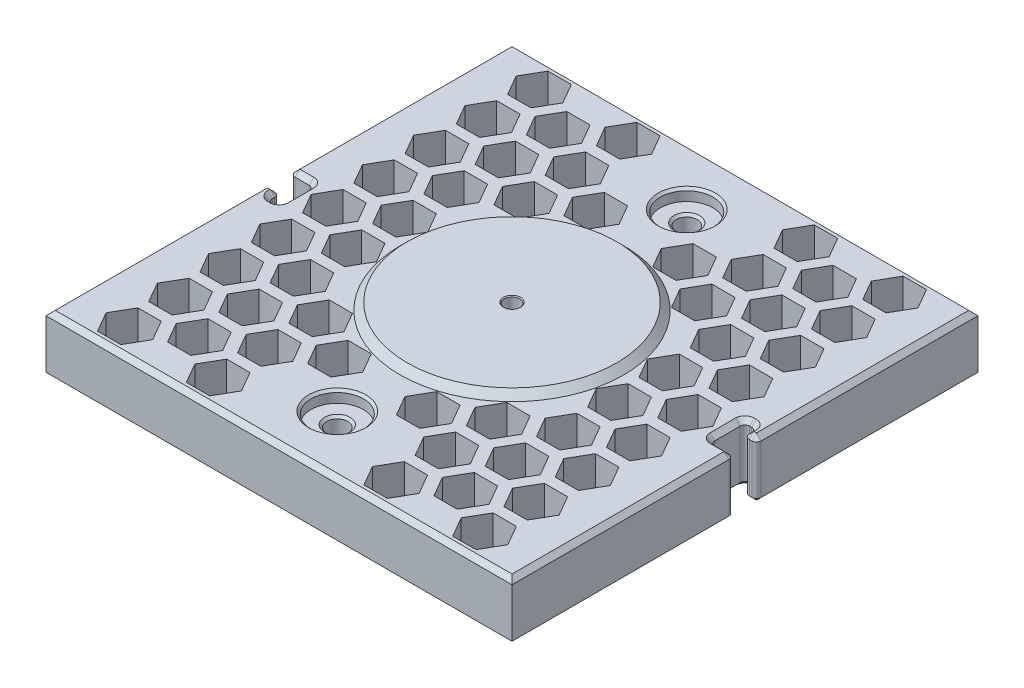
from build123d import *

# Parameters (mm, degrees)
SKETCH1_W           = 200
SKETCH1_H           = 200
BOSS_EXTRUDE1_DEPTH = 25
CUT_EXTRUDE3_REACH  = 145.614
FILLET2_R           = 2
SKETCH4_R           = 45
BOSS_EXTRUDE3_DEPTH = 3
CHAMFER1_SIZE       = 3
SKETCH5_R           = 4.5
CUT_EXTRUDE4_DEPTH  = 144.614066163
SKETCH8_R           = 11.25
CUT_EXTRUDE6_DEPTH  = 5
CHAMFER3_SIZE       = 1
FILL_PATTERN1_DEPTH = 25
CHAMFER4_SIZE       = 2
SKETCH9_R           = 3.3
CUT_EXTRUDE8_DEPTH  = 10
CHAMFER5_SIZE       = 0.4


# Read off the part's stored shape, not the designer's step: Fill Pattern1
with BuildPart() as part:
    # Sketch1 → Boss-Extrude1 (new body)
    with BuildSketch(Plane(origin=(0, 0, 0), x_dir=(1, 0, 0), z_dir=(0, 1, 0))):
        Rectangle(SKETCH1_W, SKETCH1_H)
    extrude(amount=BOSS_EXTRUDE1_DEPTH)

    # Sketch3 → Cut-Extrude3 (cut, up to next)
    with BuildSketch(Plane(origin=(0, 0, 0), x_dir=(1, 0, 0), z_dir=(0, 1, 0)), mode=Mode.PRIVATE) as cut_extrude3_sk1:
        with BuildLine():
            Line((-100, 4.95), (-92, 4.95))
            ThreePointArc((-92, 4.95), (-90.585786438, 4.364213562), (-90, 2.95))
            Line((-90, 2.95), (-90, -7.95))
            ThreePointArc((-90, -7.95), (-90.585786438, -9.364213562), (-92, -9.95))
            Line((-92, -9.95), (-92.9, -9.95))
            ThreePointArc((-92.9, -9.95), (-94.314213562, -9.364213562), (-94.9, -7.95))
            Line((-94.9, -7.95), (-94.9, -6.95))
            ThreePointArc((-94.9, -6.95), (-95.485786438, -5.535786438), (-96.9, -4.95))
            Line((-96.9, -4.95), (-100, -4.95))
            Line((-100, -4.95), (-100, 4.95))
        make_face()
    cut_extrude3_tool1 = extrude(cut_extrude3_sk1.sketch, amount=CUT_EXTRUDE3_REACH, mode=Mode.PRIVATE) & part.part
    # Sketch3 → Cut-Extrude3 (cut, up to next)
    with BuildSketch(Plane(origin=(0, 0, 0), x_dir=(1, 0, 0), z_dir=(0, 1, 0)), mode=Mode.PRIVATE) as cut_extrude3_sk2:
        with BuildLine():
            Line((100, -4.95), (92, -4.95))
            ThreePointArc((92, -4.95), (90.585786438, -4.364213562), (90, -2.95))
            Line((90, -2.95), (90, 7.95))
            ThreePointArc((90, 7.95), (90.585786438, 9.364213562), (92, 9.95))
            Line((92, 9.95), (92.9, 9.95))
            ThreePointArc((92.9, 9.95), (94.314213562, 9.364213562), (94.9, 7.95))
            Line((94.9, 7.95), (94.9, 6.95))
            ThreePointArc((94.9, 6.95), (95.485786438, 5.535786438), (96.9, 4.95))
            Line((96.9, 4.95), (100, 4.95))
            Line((100, 4.95), (100, -4.95))
        make_face()
    cut_extrude3_tool2 = extrude(cut_extrude3_sk2.sketch, amount=CUT_EXTRUDE3_REACH, mode=Mode.PRIVATE) & part.part
    add(cut_extrude3_tool1.solids().sort_by_distance((-94.557485, 0, 1.434581))[0], mode=Mode.SUBTRACT)
    add(cut_extrude3_tool2.solids().sort_by_distance((94.557485, 0, -1.434581))[0], mode=Mode.SUBTRACT)

    # Fillet2
    fillet2_edges = [part.edges().sort_by_distance(p)[0] for p in [
        (-100, 12.5, -4.95),
        (-100, 12.5, 4.95),
        (100, 12.5, 4.95),
        (100, 12.5, -4.95),
    ]]
    fillet(fillet2_edges, radius=FILLET2_R)

    # Sketch4 → Boss-Extrude3 (add)
    with BuildSketch(Plane(origin=(0, 25, 0), x_dir=(1, 0, 0), z_dir=(0, 1, 0))):
        with Locations(Location((0, 0, 0), (0, 0, 270))):
            Circle(SKETCH4_R)
    extrude(amount=BOSS_EXTRUDE3_DEPTH)

    # Chamfer1
    chamfer1_edges = [part.edges().sort_by_distance(p)[0] for p in [
        (0, 25, -45),
    ]]
    chamfer(chamfer1_edges, length=CHAMFER1_SIZE - 0.0001)  # a hair under: the kernel refuses the full size

    # Sketch5 → Cut-Extrude4 (cut, through all)
    with BuildSketch(Plane(origin=(0, 25, 0), x_dir=(1, 0, 0), z_dir=(0, 1, 0))):
        with Locations(Location((0, 75, 0), (0, 0, 270))):
            Circle(SKETCH5_R)
        with Locations(Location((0, -75, 0), (0, 0, 90))):
            Circle(SKETCH5_R)
    extrude(amount=-CUT_EXTRUDE4_DEPTH, mode=Mode.SUBTRACT)

    # Sketch8 → Cut-Extrude6 (cut)
    with BuildSketch(Plane(origin=(0, 25, 0), x_dir=(1, 0, 0), z_dir=(0, 1, 0))):
        with Locations(Location((0, 75, 0), (0, 0, 270))):
            Circle(SKETCH8_R)
        with Locations(Location((0, -75, 0), (0, 0, 90))):
            Circle(SKETCH8_R)
    extrude(amount=-CUT_EXTRUDE6_DEPTH, mode=Mode.SUBTRACT)

    # Chamfer3
    chamfer3_edges = [part.edges().sort_by_distance(p)[0] for p in [
        (0, 25, -86.25),
        (0, 20, -79.5),
        (0, 20, 79.5),
        (0, 25, 86.25),
    ]]
    chamfer(chamfer3_edges, length=CHAMFER3_SIZE)

    # Fill Pattern1 outline → Fill Pattern1 (cut)
    with BuildSketch(Plane(origin=(0, 0, 0), x_dir=(1, 0, 0), z_dir=(0, 1, 0))):
        Polygon((-86.210235533, 88), (-81.210235533, 79.339745962), (-71.210235533, 79.339745962), (-66.210235533, 88), (-71.210235533, 96.660254038), (-81.210235533, 96.660254038), align=None)
        Polygon((-67.15767665, 55), (-62.15767665, 46.339745962), (-52.15767665, 46.339745962), (-47.15767665, 55), (-52.15767665, 63.660254038), (-62.15767665, 63.660254038), align=None)
        Polygon((-43.105117767, 79.339745962), (-33.105117767, 79.339745962), (-28.105117767, 88), (-33.105117767, 96.660254038), (-43.105117767, 96.660254038), (-48.105117767, 88), align=None)
        Polygon((33.105117767, 79.339745962), (43.105117767, 79.339745962), (48.105117767, 88), (43.105117767, 96.660254038), (33.105117767, 96.660254038), (28.105117767, 88), align=None)
        Polygon((71.210235533, 79.339745962), (81.210235533, 79.339745962), (86.210235533, 88), (81.210235533, 96.660254038), (71.210235533, 96.660254038), (66.210235533, 88), align=None)
        Polygon((-86.210235533, -22), (-81.210235533, -30.660254038), (-71.210235533, -30.660254038), (-66.210235533, -22), (-71.210235533, -13.339745962), (-81.210235533, -13.339745962), align=None)
        Polygon((-48.105117767, -88), (-43.105117767, -96.660254038), (-33.105117767, -96.660254038), (-28.105117767, -88), (-33.105117767, -79.339745962), (-43.105117767, -79.339745962), align=None)
        Polygon((-67.15767665, -55), (-62.15767665, -63.660254038), (-52.15767665, -63.660254038), (-47.15767665, -55), (-52.15767665, -46.339745962), (-62.15767665, -46.339745962), align=None)
        Polygon((71.210235533, -30.660254038), (81.210235533, -30.660254038), (86.210235533, -22), (81.210235533, -13.339745962), (71.210235533, -13.339745962), (66.210235533, -22), align=None)
        Polygon((-52.15767665, 2.339745962), (-47.15767665, 11), (-52.15767665, 19.660254038), (-62.15767665, 19.660254038), (-67.15767665, 11), (-62.15767665, 2.339745962), align=None)
        Polygon((-33.105117767, 35.339745962), (-28.105117767, 44), (-33.105117767, 52.660254038), (-43.105117767, 52.660254038), (-48.105117767, 44), (-43.105117767, 35.339745962), align=None)
        Polygon((-29.052558883, -55), (-24.052558883, -63.660254038), (-14.052558883, -63.660254038), (-9.052558883, -55), (-14.052558883, -46.339745962), (-24.052558883, -46.339745962), align=None)
        Polygon((-86.210235533, 44), (-81.210235533, 35.339745962), (-71.210235533, 35.339745962), (-66.210235533, 44), (-71.210235533, 52.660254038), (-81.210235533, 52.660254038), align=None)
        Polygon((52.15767665, 2.339745962), (62.15767665, 2.339745962), (67.15767665, 11), (62.15767665, 19.660254038), (52.15767665, 19.660254038), (47.15767665, 11), align=None)
        Polygon((-86.210235533, 22), (-81.210235533, 13.339745962), (-71.210235533, 13.339745962), (-66.210235533, 22), (-71.210235533, 30.660254038), (-81.210235533, 30.660254038), align=None)
        Polygon((-67.15767665, -11), (-62.15767665, -19.660254038), (-52.15767665, -19.660254038), (-47.15767665, -11), (-52.15767665, -2.339745962), (-62.15767665, -2.339745962), align=None)
        Polygon((-48.105117767, -44), (-43.105117767, -52.660254038), (-33.105117767, -52.660254038), (-28.105117767, -44), (-33.105117767, -35.339745962), (-43.105117767, -35.339745962), align=None)
        Polygon((71.210235533, 13.339745962), (81.210235533, 13.339745962), (86.210235533, 22), (81.210235533, 30.660254038), (71.210235533, 30.660254038), (66.210235533, 22), align=None)
        Polygon((9.052558883, -55), (14.052558883, -63.660254038), (24.052558883, -63.660254038), (29.052558883, -55), (24.052558883, -46.339745962), (14.052558883, -46.339745962), align=None)
        Polygon((28.105117767, -88), (33.105117767, -96.660254038), (43.105117767, -96.660254038), (48.105117767, -88), (43.105117767, -79.339745962), (33.105117767, -79.339745962), align=None)
        Polygon((-67.15767665, 77), (-62.15767665, 68.339745962), (-52.15767665, 68.339745962), (-47.15767665, 77), (-52.15767665, 85.660254038), (-62.15767665, 85.660254038), align=None)
        Polygon((52.15767665, -63.660254038), (62.15767665, -63.660254038), (67.15767665, -55), (62.15767665, -46.339745962), (52.15767665, -46.339745962), (47.15767665, -55), align=None)
        Polygon((81.210235533, 35.339745962), (86.210235533, 44), (81.210235533, 52.660254038), (71.210235533, 52.660254038), (66.210235533, 44), (71.210235533, 35.339745962), align=None)
        Polygon((-86.210235533, 0), (-81.210235533, -8.660254038), (-71.210235533, -8.660254038), (-66.210235533, 0), (-71.210235533, 8.660254038), (-81.210235533, 8.660254038), align=None)
        Polygon((-48.105117767, -66), (-43.105117767, -74.660254038), (-33.105117767, -74.660254038), (-28.105117767, -66), (-33.105117767, -57.339745962), (-43.105117767, -57.339745962), align=None)
        Polygon((-67.15767665, -33), (-62.15767665, -41.660254038), (-52.15767665, -41.660254038), (-47.15767665, -33), (-52.15767665, -24.339745962), (-62.15767665, -24.339745962), align=None)
        Polygon((71.210235533, -8.660254038), (81.210235533, -8.660254038), (86.210235533, 0), (81.210235533, 8.660254038), (71.210235533, 8.660254038), (66.210235533, 0), align=None)
        Polygon((-52.15767665, 24.339745962), (-47.15767665, 33), (-52.15767665, 41.660254038), (-62.15767665, 41.660254038), (-67.15767665, 33), (-62.15767665, 24.339745962), align=None)
        Polygon((-33.105117767, 57.339745962), (-28.105117767, 66), (-33.105117767, 74.660254038), (-43.105117767, 74.660254038), (-48.105117767, 66), (-43.105117767, 57.339745962), align=None)
        Polygon((-81.210235533, -96.660254038), (-71.210235533, -96.660254038), (-66.210235533, -88), (-71.210235533, -79.339745962), (-81.210235533, -79.339745962), (-86.210235533, -88), align=None)
        Polygon((71.210235533, -96.660254038), (81.210235533, -96.660254038), (86.210235533, -88), (81.210235533, -79.339745962), (71.210235533, -79.339745962), (66.210235533, -88), align=None)
        Polygon((62.15767665, 68.339745962), (67.15767665, 77), (62.15767665, 85.660254038), (52.15767665, 85.660254038), (47.15767665, 77), (52.15767665, 68.339745962), align=None)
        Polygon((43.105117767, 35.339745962), (48.105117767, 44), (43.105117767, 52.660254038), (33.105117767, 52.660254038), (28.105117767, 44), (33.105117767, 35.339745962), align=None)
        Polygon((-86.210235533, -66), (-81.210235533, -74.660254038), (-71.210235533, -74.660254038), (-66.210235533, -66), (-71.210235533, -57.339745962), (-81.210235533, -57.339745962), align=None)
        Polygon((33.105117767, -74.660254038), (43.105117767, -74.660254038), (48.105117767, -66), (43.105117767, -57.339745962), (33.105117767, -57.339745962), (28.105117767, -66), align=None)
        Polygon((71.210235533, -74.660254038), (81.210235533, -74.660254038), (86.210235533, -66), (81.210235533, -57.339745962), (71.210235533, -57.339745962), (66.210235533, -66), align=None)
        Polygon((-67.15767665, -77), (-62.15767665, -85.660254038), (-52.15767665, -85.660254038), (-47.15767665, -77), (-52.15767665, -68.339745962), (-62.15767665, -68.339745962), align=None)
        Polygon((-86.210235533, -44), (-81.210235533, -52.660254038), (-71.210235533, -52.660254038), (-66.210235533, -44), (-71.210235533, -35.339745962), (-81.210235533, -35.339745962), align=None)
        Polygon((52.15767665, -85.660254038), (62.15767665, -85.660254038), (67.15767665, -77), (62.15767665, -68.339745962), (52.15767665, -68.339745962), (47.15767665, -77), align=None)
        Polygon((24.052558883, 46.339745962), (29.052558883, 55), (24.052558883, 63.660254038), (14.052558883, 63.660254038), (9.052558883, 55), (14.052558883, 46.339745962), align=None)
        Polygon((62.15767665, -41.660254038), (67.15767665, -33), (62.15767665, -24.339745962), (52.15767665, -24.339745962), (47.15767665, -33), (52.15767665, -41.660254038), align=None)
        Polygon((-86.210235533, 66), (-81.210235533, 57.339745962), (-71.210235533, 57.339745962), (-66.210235533, 66), (-71.210235533, 74.660254038), (-81.210235533, 74.660254038), align=None)
        Polygon((52.15767665, 24.339745962), (62.15767665, 24.339745962), (67.15767665, 33), (62.15767665, 41.660254038), (52.15767665, 41.660254038), (47.15767665, 33), align=None)
        Polygon((66.210235533, -44), (71.210235533, -52.660254038), (81.210235533, -52.660254038), (86.210235533, -44), (81.210235533, -35.339745962), (71.210235533, -35.339745962), align=None)
        Polygon((47.15767665, -11), (52.15767665, -19.660254038), (62.15767665, -19.660254038), (67.15767665, -11), (62.15767665, -2.339745962), (52.15767665, -2.339745962), align=None)
        Polygon((-24.052558883, 46.339745962), (-14.052558883, 46.339745962), (-9.052558883, 55), (-14.052558883, 63.660254038), (-24.052558883, 63.660254038), (-29.052558883, 55), align=None)
        Polygon((52.15767665, 46.339745962), (62.15767665, 46.339745962), (67.15767665, 55), (62.15767665, 63.660254038), (52.15767665, 63.660254038), (47.15767665, 55), align=None)
        Polygon((43.105117767, 57.339745962), (48.105117767, 66), (43.105117767, 74.660254038), (33.105117767, 74.660254038), (28.105117767, 66), (33.105117767, 57.339745962), align=None)
        Polygon((33.105117767, -52.660254038), (43.105117767, -52.660254038), (48.105117767, -44), (43.105117767, -35.339745962), (33.105117767, -35.339745962), (28.105117767, -44), align=None)
        Polygon((71.210235533, 57.339745962), (81.210235533, 57.339745962), (86.210235533, 66), (81.210235533, 74.660254038), (71.210235533, 74.660254038), (66.210235533, 66), align=None)
    extrude(amount=FILL_PATTERN1_DEPTH, mode=Mode.SUBTRACT)

    # Chamfer4
    chamfer4_edges = [part.edges().sort_by_distance(p)[0] for p in [
        (-100, 25, -53.475),
        (0, 25, 100),
        (-95.485786438, 0, 5.535786438),
        (-94.9, 0, 7.45),
        (-94.314213562, 0, 9.364213562),
        (-92.45, 0, 9.95),
        (-90.585786438, 0, 9.364213562),
        (-90, 0, 2.5),
        (-90.585786438, 0, -4.364213562),
        (-95, 0, -4.95),
        (-95.485786438, 25, 5.535786438),
        (-94.9, 25, 7.45),
        (-94.314213562, 25, 9.364213562),
        (-92.45, 25, 9.95),
        (-90.585786438, 25, 9.364213562),
        (-90, 25, 2.5),
        (-90.585786438, 25, -4.364213562),
        (-95, 25, -4.95),
        (95.485786438, 0, -5.535786438),
        (94.9, 0, -7.45),
        (94.314213562, 0, -9.364213562),
        (92.45, 0, -9.95),
        (90.585786438, 0, -9.364213562),
        (90, 0, -2.5),
        (90.585786438, 0, 4.364213562),
        (95, 0, 4.95),
        (95.485786438, 25, -5.535786438),
        (94.9, 25, -7.45),
        (94.314213562, 25, -9.364213562),
        (92.45, 25, -9.95),
        (90.585786438, 25, -9.364213562),
        (90, 25, -2.5),
        (90.585786438, 25, 4.364213562),
        (95, 25, 4.95),
        (100, 25, 53.475),
        (0, 0, 100),
        (-100, 0, -53.475),
        (0, 0, -100),
        (100, 0, 53.475),
        (-97.45, 0, 4.95),
        (100, 0, -53.475),
        (97.45, 0, -4.95),
        (-100, 0, 53.475),
        (-99.414213562, 0, -5.535786438),
        (-99.414213562, 0, 5.535786438),
        (99.414213562, 0, -5.535786438),
        (99.414213562, 0, 5.535786438),
        (-97.45, 25, 4.95),
        (-100, 25, 53.475),
        (97.45, 25, -4.95),
        (100, 25, -53.475),
        (-99.414213562, 25, -5.535786438),
        (-99.414213562, 25, 5.535786438),
        (99.414213562, 25, -5.535786438),
        (99.414213562, 25, 5.535786438),
        (0, 25, -100),
    ]]
    chamfer(chamfer4_edges, length=CHAMFER4_SIZE - 0.0001)  # a hair under: the kernel refuses the full size

    # Sketch9 → Cut-Extrude8 (cut)
    with BuildSketch(Plane(origin=(0, 28, 0), x_dir=(1, 0, 0), z_dir=(0, 1, 0))):
        with Locations(Location((0, 0, 0), (0, 0, 270))):
            Circle(SKETCH9_R)
    extrude(amount=-CUT_EXTRUDE8_DEPTH, mode=Mode.SUBTRACT)

    # Chamfer5
    chamfer5_edges = [part.edges().sort_by_distance(p)[0] for p in [
        (0, 28, -3.3),
    ]]
    chamfer(chamfer5_edges, length=CHAMFER5_SIZE)


solid = part.part
